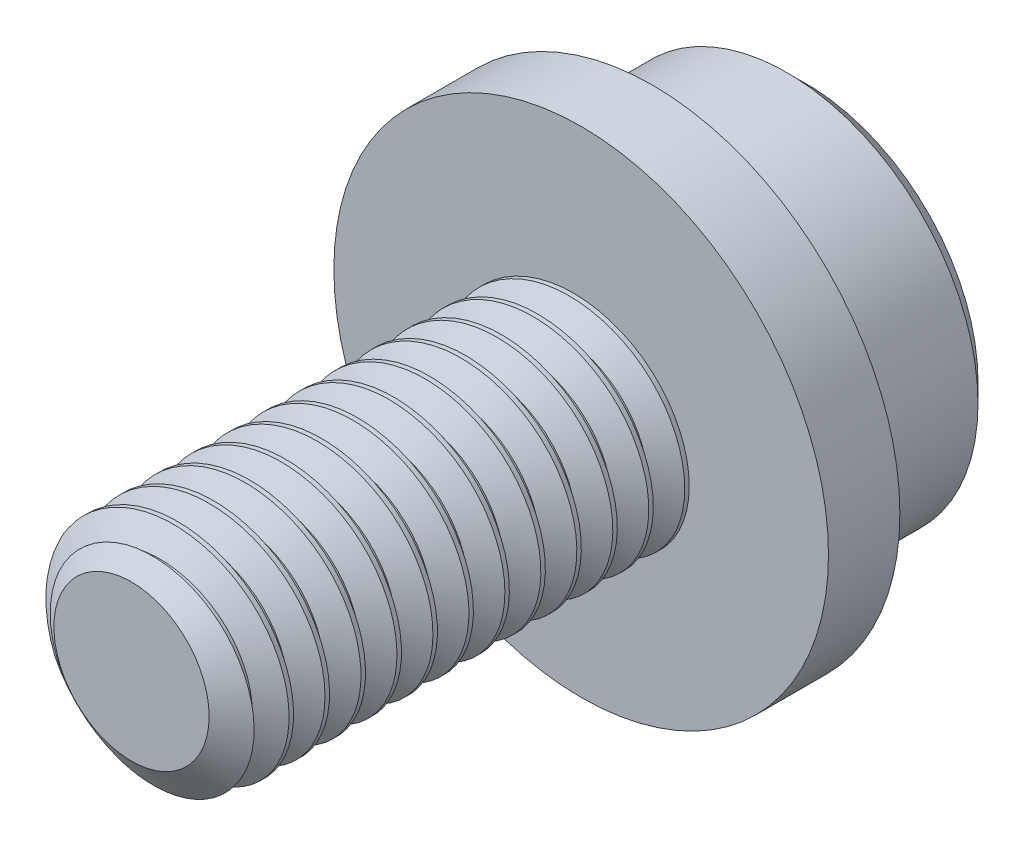
from build123d import *

# Parameters (mm, degrees)
SKETCH1_R           = 2.5
EXTRUDE1_DEPTH      = 10
CUT_SWEEP1_PITCH    = 0.8
SKETCH6_R           = 4.25
EXTRUDE2_DEPTH      = 5
SKETCH10_R          = 5.5
BOSS_EXTRUDE1_DEPTH = 1.5875
CUT_EXTRUDE1_DEPTH  = 3
CHAMFER1_SIZE       = 0.425
FILLET1_R           = 0.396875


with BuildPart() as part:
    # Sketch1 → Extrude1 (new body)
    with BuildSketch(Plane.XY):
        Circle(SKETCH1_R)
    extrude(amount=-EXTRUDE1_DEPTH)

    # Cut-Sweep1: the profile of Sketch3 profile screwed along a right-hand helix of 13.5 turns, 6 arcs to a turn; built about Z, then put on its axis
    cut_sweep1_z = Axis((0, 0, 0), (0, 0, 1))
    cut_sweep1_corners = [(2.5003, 0, -0.700173205), (1.980384758, 0, -0.4), (1.980384758, 0, -0.3), (2.5003, 0, 0.000173205)]
    with BuildLine(mode=Mode.PRIVATE) as cut_sweep1_profile:
        Line(cut_sweep1_corners[0], cut_sweep1_corners[1])
        Line(cut_sweep1_corners[1], cut_sweep1_corners[2])
        Line(cut_sweep1_corners[2], cut_sweep1_corners[3])
        Line(cut_sweep1_corners[3], cut_sweep1_corners[0])
    cut_sweep1_cap = Face(cut_sweep1_profile.wire())
    cut_sweep1_turn_angles = [0, 30, 60, 90, 120, 150, 180, 210, 240, 270, 300, 330, 360]
    cut_sweep1_turn_weights = [1, 0.8660254037844387, 1, 0.8660254037844387, 1, 0.8660254037844387, 1, 0.8660254037844387, 1, 0.8660254037844387, 1, 0.8660254037844387, 1]
    cut_sweep1_turn_rails = [Edge.make_bspline([Vector(p[0], p[1], 0).rotate(cut_sweep1_z, cut_sweep1_turn_angles[k]) / cut_sweep1_turn_weights[k] + Vector(0, 0, p[2] + CUT_SWEEP1_PITCH * cut_sweep1_turn_angles[k] / 360) for k in range(13)], [0, 0, 0, 1, 1, 2, 2, 3, 3, 4, 4, 5, 5, 6, 6, 6], 2, cut_sweep1_turn_weights) for p in cut_sweep1_corners]
    cut_sweep1_turn_sides = [Face.make_surface_from_curves(cut_sweep1_turn_rails[p[0]], cut_sweep1_turn_rails[p[1]]) for p in [(0, 1), (1, 2), (2, 3), (3, 0)]]
    cut_sweep1_last_angles = [4680, 4710, 4740, 4770, 4800, 4830, 4860]
    cut_sweep1_last_weights = [1, 0.8660254037844387, 1, 0.8660254037844387, 1, 0.8660254037843435, 1]
    cut_sweep1_last_rails = [Edge.make_bspline([Vector(p[0], p[1], 0).rotate(cut_sweep1_z, cut_sweep1_last_angles[k]) / cut_sweep1_last_weights[k] + Vector(0, 0, p[2] + CUT_SWEEP1_PITCH * cut_sweep1_last_angles[k] / 360) for k in range(7)], [0, 0, 0, 1, 1, 2, 2, 3, 3, 3], 2, cut_sweep1_last_weights) for p in cut_sweep1_corners]
    cut_sweep1_last_sides = [Face.make_surface_from_curves(cut_sweep1_last_rails[p[0]], cut_sweep1_last_rails[p[1]]) for p in [(0, 1), (1, 2), (2, 3), (3, 0)]]
    cut_sweep1 = Plane(origin=(0, 0, 0), x_dir=(0, 1, 0), z_dir=(0, 0, -1)) * Solid(Shell([*[p.moved(Location((0, 0, CUT_SWEEP1_PITCH * i))) for i in range(13) for p in cut_sweep1_turn_sides], *cut_sweep1_last_sides, cut_sweep1_cap, cut_sweep1_cap.rotate(cut_sweep1_z, 4860).moved(Location((0, 0, CUT_SWEEP1_PITCH * 4860 / 360)))]))
    add(cut_sweep1, mode=Mode.SUBTRACT)

    # Sketch4 → Cut-Revolve1 (revolve, cut)
    with BuildSketch(Plane(origin=(0, 0, 0), x_dir=(0, 0, -1), z_dir=(1, 0, 0)), mode=Mode.PRIVATE) as cut_revolve1_sk:
        Polygon((0.541691224, 2.5), (0, 1.726384758), (0, 2.5), align=None)
    revolve(cut_revolve1_sk.sketch.rotate(Axis((0, 0, 0), (0, 0, -1)), 260.43858876), axis=Axis((0, 0, 0), (0, 0, -1)), mode=Mode.SUBTRACT)

    # Sketch6 → Extrude2 (add)
    with BuildSketch(Plane(origin=(0, 0, -10), x_dir=(-1, 0, 0), z_dir=(0, 0, -1))):
        Circle(SKETCH6_R)
    extrude(amount=EXTRUDE2_DEPTH)

    # Sketch10 → Boss-Extrude1 (add)
    with BuildSketch(Plane.XY.offset(-10)):
        Circle(SKETCH10_R)
    extrude(amount=-BOSS_EXTRUDE1_DEPTH)

    # Sketch7 → Cut-Extrude1 (cut)
    with BuildSketch(Plane(origin=(0, 0, -15), x_dir=(-1, 0, 0), z_dir=(0, 0, -1))):
        Polygon((0, 2.309401077), (-2, 1.154700538), (-2, -1.154700538), (0, -2.309401077), (2, -1.154700538), (2, 1.154700538), align=None)
    extrude(amount=-CUT_EXTRUDE1_DEPTH, mode=Mode.SUBTRACT)

    # Cut-Extrude2 cone 1 section (through the dimple's axis) → Cut-Extrude2 (revolve, cut)
    with BuildSketch(Plane(origin=(0, 0, -15), x_dir=(0, 1, 0), z_dir=(1, 0, 0))):
        Polygon((0, 0), (2.309401077, 0), (0, 2.309401077), align=None)
    revolve(axis=Axis((0, 0, -15), (0, 0, 1)), mode=Mode.SUBTRACT)

    # Chamfer1
    chamfer1_edges = [part.edges().sort_by_distance(p)[0] for p in [
        (4.25, 0, -15),
    ]]
    chamfer(chamfer1_edges, length=CHAMFER1_SIZE)

    # Fillet1
    fillet1_edges = [part.edges().sort_by_distance(p)[0] for p in [
        (4.25, 0, -11.5875),
    ]]
    fillet(fillet1_edges, radius=FILLET1_R)


solid = part.part
